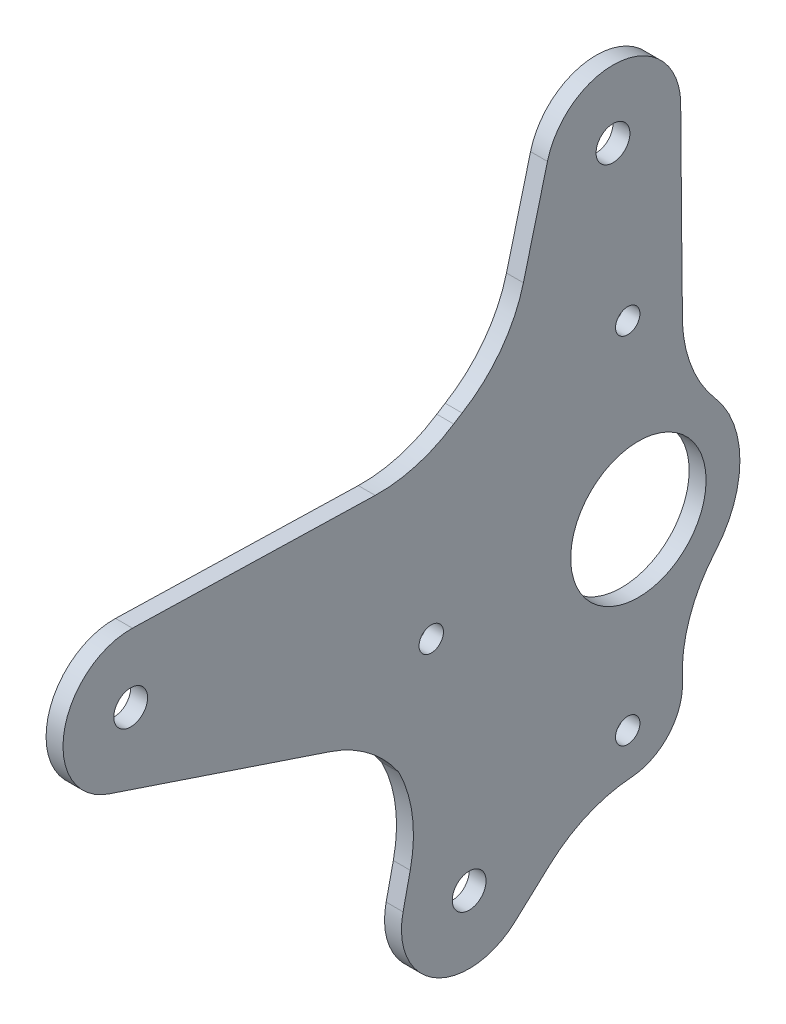
from build123d import *

# Parameters (mm, degrees)
SKETCH1_W          = 101.6
SKETCH1_H          = 82.55
SKETCH1_R          = 12.7
BASE_FLANGE1_DEPTH = 3.175
SKETCH6_R          = 2.286
CUT_EXTRUDE1_DEPTH = 66.531261624
SKETCH7_R          = 3.175
TAB1_DEPTH         = 3.175
FILLET1_R          = 25.4


# Sheet-metal steps are written as plain solids
with BuildPart() as part:
    # Sketch1 → Base-Flange1 (new body)
    with BuildSketch(Plane(origin=(0, 0, 0), x_dir=(0, 0, -1), z_dir=(1, 0, 0))):
        Rectangle(SKETCH1_W, SKETCH1_H)
        Circle(SKETCH1_R, mode=Mode.SUBTRACT)
    extrude(amount=-BASE_FLANGE1_DEPTH)

    # Sketch6 → Cut-Extrude1 (cut, through all)
    with BuildSketch(Plane(origin=(0, 0, 0), x_dir=(0, 0, -1), z_dir=(1, 0, 0))):
        with BuildLine():
            Line((-50.8, 0), (-50.8, -41.275))
            Line((-50.8, -41.275), (-2, -41.275))
            add(Edge.make_bspline(
                [(-50.8, 0), (-49.405200746, -20.6375), (-31.743734825, -41.275), (-2, -41.275)],
                knots=[0.5, 0.5, 0.5, 0.5, 1, 1, 1, 1], degree=3))
        make_face()
        with BuildLine():
            ThreePointArc((8.260015314, -30.445283168), (5.45906631, -38.06667919), (-2, -41.275))
            Line((-2, -41.275), (50.8, -41.275))
            Line((50.8, -41.275), (50.8, 41.275))
            Line((50.8, 41.275), (-2, 41.275))
            ThreePointArc((-2, 41.275), (5.45906631, 38.06667919), (8.260015314, 30.445283168))
            ThreePointArc((8.260015314, 30.445283168), (9.58920866, 20.855850918), (14.409845519, 12.460291013))
            ThreePointArc((14.409845519, 12.460291013), (19.05, 0), (14.409845519, -12.460291013))
            ThreePointArc((14.409845519, -12.460291013), (9.58920866, -20.855850918), (8.260015314, -30.445283168))
        make_face()
        with BuildLine():
            Line((-50.8, 41.275), (-50.8, 5.257542394))
            add(Edge.make_bspline(
                [(-2, 41.275), (-34.31608403, 41.275), (-49.514685749, 24.001471649), (-50.8, 5.257542394)],
                knots=[0, 0, 0, 0, 0.457437737, 0.457437737, 0.457437737, 0.457437737], degree=3))
            Line((-2, 41.275), (-50.8, 41.275))
        make_face()
        with Locations((-38.862, 0)):
            Circle(SKETCH6_R)
        with Locations((-2, -33.274)):
            Circle(SKETCH6_R)
        with Locations((-2, 33.274)):
            Circle(SKETCH6_R)
    extrude(amount=-CUT_EXTRUDE1_DEPTH, mode=Mode.SUBTRACT)

    # Sketch7 → Tab1 (add)
    # profile 1 of 3: a face of its own
    with BuildSketch(Plane(origin=(0, 0, 0), x_dir=(0, 0, -1), z_dir=(1, 0, 0))):
        with BuildLine():
            Line((-94.917552756, 29.770648167), (-40.208700014, 28.33804644))
            add(Edge.make_bspline(
                [(-40.208700014, 28.33804644), (-46.786875633, 21.92230562), (-50.218303551, 13.740508394), (-50.8, 5.257542394)],
                knots=[0.250414508, 0.250414508, 0.250414508, 0.250414508, 0.457437737, 0.457437737, 0.457437737, 0.457437737], degree=3))
            Line((-50.8, 5.257542394), (-50.8, 0))
            add(Edge.make_bspline(
                [(-50.8, 0), (-50.523888569, -4.085354674), (-49.610330365, -8.170709348), (-48.091785573, -12.095969996)],
                knots=[0.5, 0.5, 0.5, 0.5, 0.598978914, 0.598978914, 0.598978914, 0.598978914], degree=3))
            Line((-48.091785573, -12.095969996), (-99.279769136, 5.031289719))
            ThreePointArc((-99.279769136, 5.031289719), (-107.757058463, 19.280331996), (-94.917552756, 29.770648167))
        make_face()
        with Locations((-95.25, 17.07500014)):
            Circle(SKETCH7_R, mode=Mode.SUBTRACT)
    # profile 2 of 3: a face of its own
    with BuildSketch(Plane(origin=(0, 0, 0), x_dir=(0, 0, -1), z_dir=(1, 0, 0))):
        with BuildLine():
            Line((-44.14895929, -41.701216903), (-40.415374595, -24.860104669))
            add(Edge.make_bspline(
                [(-40.415374595, -24.860104669), (-33.280436064, -33.135041664), (-22.659787261, -39.285311117), (-9.047775931, -40.872784018)],
                knots=[0.713798262, 0.713798262, 0.713798262, 0.713798262, 0.959139114, 0.959139114, 0.959139114, 0.959139114], degree=3))
            Line((-9.047775931, -40.872784018), (-23.170004363, -53.813422177))
            ThreePointArc((-23.170004363, -53.813422177), (-38.1, -55.448522628), (-44.14895929, -41.701216903))
        make_face()
        with Locations((-31.75, -44.45)):
            Circle(SKETCH7_R, mode=Mode.SUBTRACT)
    # profile 3 of 3: a face of its own
    with BuildSketch(Plane(origin=(0, 0, 0), x_dir=(0, 0, -1), z_dir=(1, 0, 0))):
        with BuildLine():
            Line((7.937016423, 63.610827001), (8.211666218, 32.13907772))
            ThreePointArc((8.211666218, 32.13907772), (4.850970786, 38.657664415), (-2, 41.275))
            add(Edge.make_bspline(
                [(-2, 41.275), (-10.740165269, 41.275), (-18.228222741, 40.011477764), (-24.527562549, 37.79707419)],
                knots=[0, 0, 0, 0, 0.123718004, 0.123718004, 0.123718004, 0.123718004], degree=3))
            Line((-24.527562549, 37.79707419), (-17.057975033, 66.679826051))
            ThreePointArc((-17.057975033, 66.679826051), (-3.214759339, 76.105336126), (7.937016423, 63.610827001))
        make_face()
        with Locations((-4.7625, 63.5)):
            Circle(SKETCH7_R, mode=Mode.SUBTRACT)
    extrude(amount=-TAB1_DEPTH)

    # Fillet1
    # the kernel refuses this fillet: 25.4 mm, written as the material it adds along each edge
    with BuildSketch(Plane(origin=(0, -12.095969996, 48.091785573), x_dir=(0, -0.8940853076070706, -0.44789670987982283), z_dir=(-1, 0, 0))) as fillet1_piece_1:
        with BuildLine():
            CenterArc((10.606420456, 25.28678712), FILLET1_R, 225.10881891, 39.479525683)
            Line((-7.319947942, 7.29219582), (-7.67847531, 6.932303994))
            Line((-7.67847531, 6.932303994), (-0.358527368, -0.359891826))
            Line((-0.358527368, -0.359891826), (0.04832888, -0.505695876))
            ThreePointArc((0.04832888, -0.505695876), (4.105397819, -0.313189565), (8.163015374, -0.505735742))
            Line((8.163015374, -0.505735742), (8.210925278, 0))
        make_face()
    extrude(amount=3.175)
    with BuildSketch(Plane(origin=(0, -24.860104669, 40.415374595), x_dir=(0, 0.8184198405618281, 0.5746207136666339), z_dir=(-1, 0, 0))) as fillet1_piece_2:
        with BuildLine():
            CenterArc((11.311656293, -25.273029086), FILLET1_R, 95.731310995, 41.841763873)
            Line((-7.437058628, -8.136935925), (-7.812032926, -7.794214062))
            Line((-7.812032926, -7.794214062), (-0.374974298, 0.342721863))
            Line((-0.374974298, 0.342721863), (0.050418969, 0.505491768))
            ThreePointArc((0.050418969, 0.505491768), (4.387605763, 0.289082367), (8.724392403, 0.505460582))
            Line((8.724392403, 0.505460582), (8.775123067, 0))
        make_face()
    extrude(amount=3.175)
    with BuildSketch(Plane(origin=(0, -40.872784018, 9.047775931), x_dir=(0, -0.04853483979472319, -0.9988214902204), z_dir=(-1, 0, 0))) as fillet1_piece_3:
        with BuildLine():
            CenterArc((10.770038636, 25.222537483), FILLET1_R, 224.718065589, 38.505093781)
            Line((-7.27863381, 7.350620325), (-9.083501055, 5.563428609))
            Line((-9.083501055, 5.563428609), (-1.804867245, -1.787191716))
            Line((-1.804867245, -1.787191716), (0.171432812, -2.534208119))
            ThreePointArc((0.171432812, -2.534208119), (6.935713053, -2.477327294), (7.473046138, -2.522253748))
            Line((7.473046138, -2.522253748), (7.772772728, 0))
        make_face()
    extrude(amount=3.175)
    with BuildSketch(Plane(origin=(0, 28.33804644, 40.208700014), x_dir=(0, 0.6273452084860717, -0.7787412852735929), z_dir=(-1, 0, 0))) as fillet1_piece_4:
        with BuildLine():
            CenterArc((9.459006839, -25.293729314), FILLET1_R, 95.242990238, 35.111537056)
            Line((-6.987881866, -5.937597161), (-7.31681964, -5.550474518))
            Line((-7.31681964, -5.550474518), (-0.328937774, 0.387122643))
            Line((-0.328937774, 0.387122643), (0.048065336, 0.505720994))
            ThreePointArc((0.048065336, 0.505720994), (3.568700205, 0.341549606), (7.091539297, 0.505874586))
            Line((7.091539297, 0.505874586), (7.137960229, 0))
        make_face()
    extrude(amount=3.175)
    with BuildSketch(Plane(origin=(0, 37.79707419, 24.527562549), x_dir=(0, -0.42252064373268267, 0.9063533006613478), z_dir=(-1, 0, 0))) as fillet1_piece_5:
        with BuildLine():
            CenterArc((12.096936965, 25.25943543), FILLET1_R, 219.493828852, 44.475589611)
            Line((-7.504067493, 9.105159703), (-7.896087582, 8.782074189))
            Line((-7.896087582, 8.782074189), (-0.392020089, -0.323085515))
            Line((-0.392020089, -0.323085515), (0.049799336, -0.505553188))
            ThreePointArc((0.049799336, -0.505553188), (4.714693558, -0.268029159), (9.375061322, -0.505188709))
            Line((9.375061322, -0.505188709), (9.428431432, 0))
        make_face()
    extrude(amount=3.175)
    with BuildSketch(Plane(origin=(0, 32.13907772, -8.211666218), x_dir=(0, -0.9961860509350137, -0.08725452379391116), z_dir=(-1, 0, 0))) as fillet1_piece_6:
        with BuildLine():
            CenterArc((1.089917285, -25.392853706), FILLET1_R, 91.359162517, 3.146518864)
            Line((-0.905454606, -0.071351164), (-0.945362044, 0.435078887))
            Line((-0.945362044, 0.435078887), (-0.039907438, 0.506430051))
            Line((-0.039907438, 0.506430051), (0.012049575, 0.507857074))
            ThreePointArc((0.012049575, 0.507857074), (0.243719262, 0.505109127), (0.47538895, 0.507857074))
            Line((0.47538895, 0.507857074), (0.487438525, 0))
        make_face()
    extrude(amount=3.175)


solid = part.part
